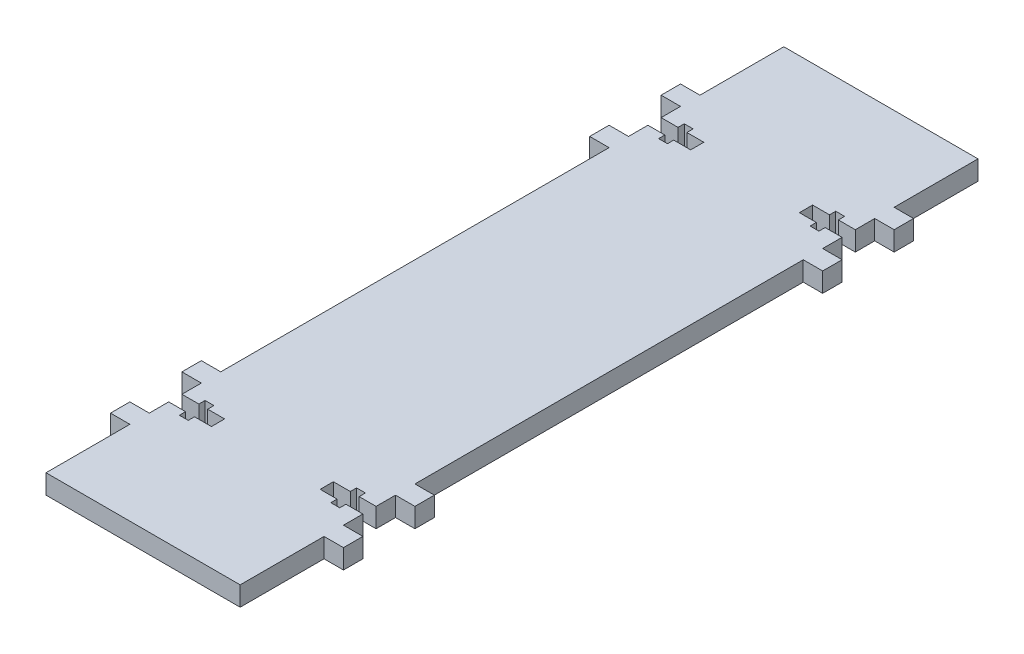
from build123d import *

# Parameters (mm, degrees)
BOSS_EXTRUDE1_DEPTH = 6.35


with BuildPart() as part:
    # Elevator Belt Backplate → Boss-Extrude1 (new body)
    with BuildSketch(Plane(origin=(0, 0, 0), x_dir=(1, 0, 0), z_dir=(0, 1, 0))):
        Polygon((-31.75, 63.5), (-31.75, -63.5), (-38.1, -63.5), (-38.1, -69.85), (-31.75, -69.85), (-31.75, -76.2), (-26.215000021, -76.2), (-26.215000021, -74.159000018), (-23.314999979, -74.159000018), (-23.314999979, -76.2), (-17.78, -76.2), (-17.78, -80.518), (-23.314999979, -80.518), (-23.314999979, -82.558999982), (-26.215000021, -82.558999982), (-26.215000021, -80.518), (-31.75, -80.518), (-31.75, -86.868), (-38.1, -86.868), (-38.1, -93.218), (-31.75, -93.218), (-31.75, -120.65), (31.75, -120.65), (31.75, -93.218), (38.1, -93.218), (38.1, -86.868), (31.75, -86.868), (31.75, -80.518), (26.215000021, -80.518), (26.215000021, -82.558999982), (23.314999979, -82.558999982), (23.314999979, -80.518), (17.78, -80.518), (17.78, -76.2), (23.314999979, -76.2), (23.314999979, -74.159000018), (26.215000021, -74.159000018), (26.215000021, -76.2), (31.75, -76.2), (31.75, -69.85), (38.1, -69.85), (38.1, -63.5), (31.75, -63.5), (31.75, 63.5), (38.1, 63.5), (38.1, 69.85), (31.75, 69.85), (31.75, 76.2), (26.215000021, 76.2), (26.215000021, 74.159000018), (23.314999979, 74.159000018), (23.314999979, 76.2), (17.78, 76.2), (17.78, 80.518), (23.314999979, 80.518), (23.314999979, 82.558999982), (26.215000021, 82.558999982), (26.215000021, 80.518), (31.75, 80.518), (31.75, 86.868), (38.1, 86.868), (38.1, 93.218), (31.75, 93.218), (31.75, 120.65), (-31.75, 120.65), (-31.75, 93.218), (-38.1, 93.218), (-38.1, 86.868), (-31.75, 86.868), (-31.75, 80.518), (-26.215000021, 80.518), (-26.215000021, 82.558999982), (-23.314999979, 82.558999982), (-23.314999979, 80.518), (-17.78, 80.518), (-17.78, 76.2), (-23.314999979, 76.2), (-23.314999979, 74.159000018), (-26.215000021, 74.159000018), (-26.215000021, 76.2), (-31.75, 76.2), (-31.75, 69.85), (-38.1, 69.85), (-38.1, 63.5), align=None)
    extrude(amount=BOSS_EXTRUDE1_DEPTH)


solid = part.part
